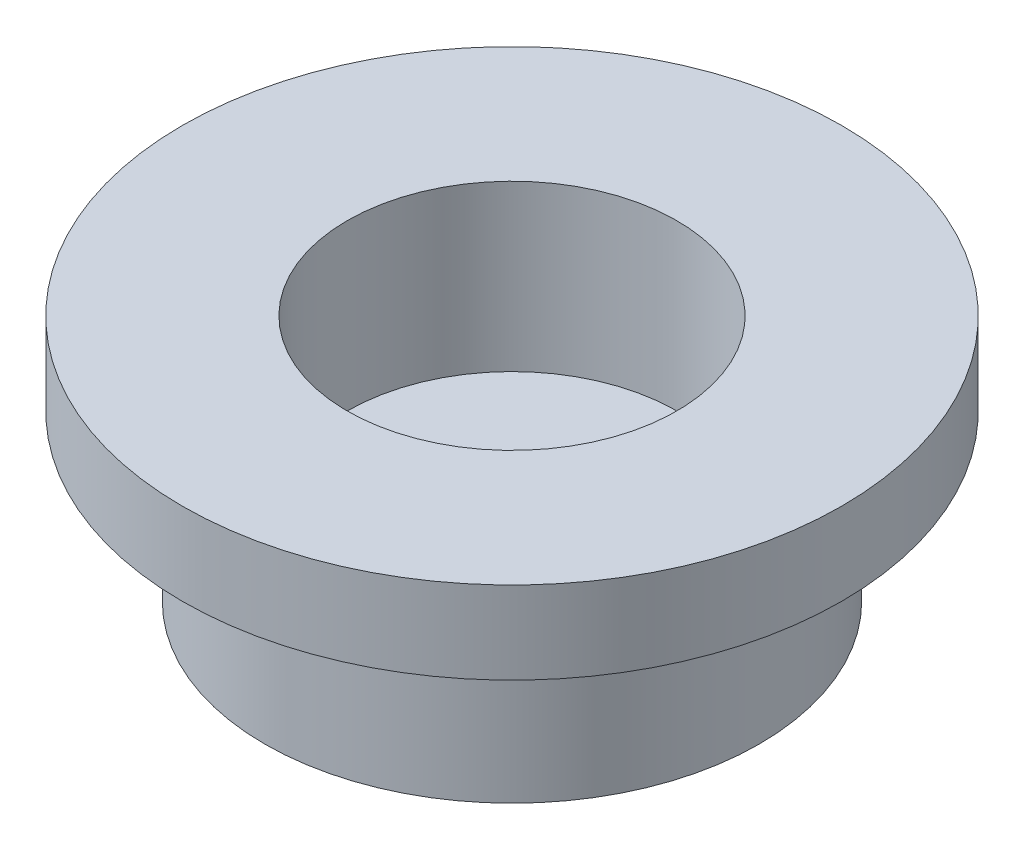
from build123d import *


with BuildPart() as part:
    # Sketch1 → Revolve1 (revolve)
    with BuildSketch(Plane.XY):
        Polygon((0, -6), (6, -6), (6, -2), (8, -2), (8, 0), (4, 0), (4, -4), (0, -4), align=None)
    revolve(axis=Axis((0, 0, 0), (0, -1, 0)))


solid = part.part
